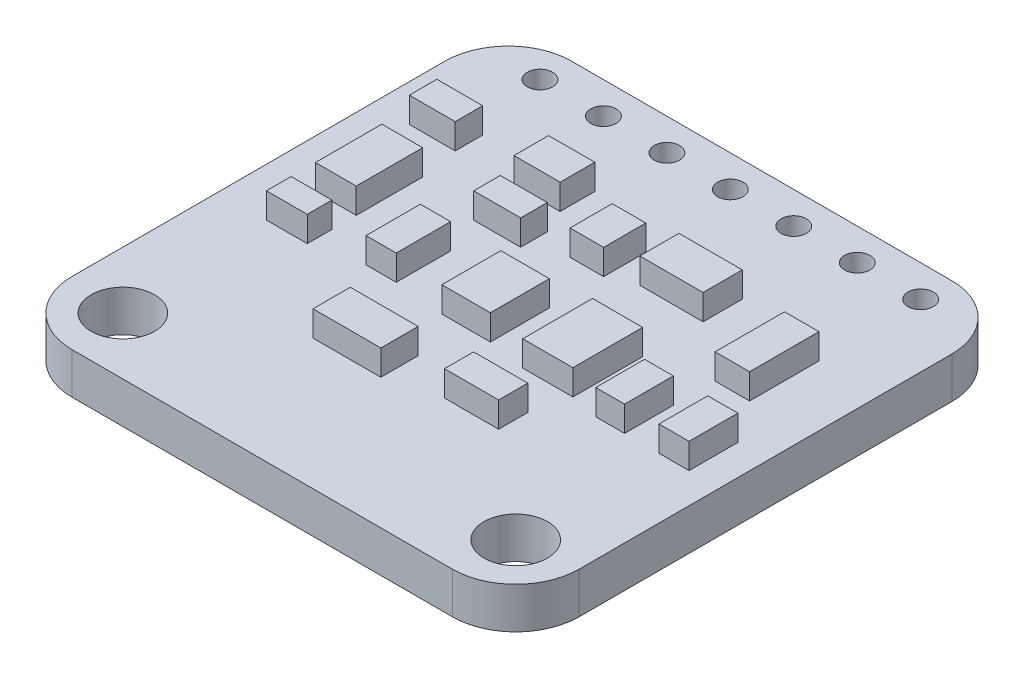
from build123d import *

# Parameters (mm, degrees)
PCB_DEPTH          = 1.651
SKETCH2_R          = 1.27
SKETCH2_R_2        = 0.508
CUT_EXTRUDE1_DEPTH = 15.343929064
SKETCH3_W          = 1.9431
SKETCH3_H          = 2.3622
SKETCH3_W_2        = 2.0066
SKETCH3_H_2        = 2.794
SKETCH3_W_3        = 2.16822249
SKETCH3_H_3        = 1.167787324
SKETCH3_W_4        = 2.716171955
SKETCH3_H_4        = 1.493517176
SKETCH3_W_5        = 1.209663862
SKETCH3_H_5        = 2.17508788
SKETCH3_W_6        = 1.633321627
SKETCH3_H_6        = 2.659890245
SKETCH3_W_7        = 1.834361491
SKETCH3_H_7        = 1.100221283
SKETCH3_W_8        = 1.848311781
SKETCH3_H_8        = 1.38602823
SKETCH3_W_9        = 1.877433771
SKETCH3_H_9        = 1.066217503
SKETCH3_H_10       = 0.988618516
SKETCH3_W_10       = 1.152895283
SKETCH3_H_11       = 1.952725423
SKETCH3_W_11       = 1.201658639
SKETCH3_W_12       = 1.378437796
SKETCH3_H_12       = 2.778082819
SKETCH3_W_13       = 2.534678464
SKETCH3_H_13       = 1.568516227
SKETCH3_W_14       = 1.344087022
SKETCH3_H_14       = 1.688234225
COMPONENTS_DEPTH   = 1.016


with BuildPart() as part:
    # Sketch1 → pcb (new body)
    with BuildSketch(Plane(origin=(0, 0, 0), x_dir=(1, 0, 0), z_dir=(0, 1, 0))):
        with BuildLine():
            Line((-7.61, -10), (7.61, -10))
            ThreePointArc((7.61, -10), (9.406051224, -9.256051224), (10.15, -7.46))
            Line((10.15, -7.46), (10.15, 7.46))
            ThreePointArc((10.15, 7.46), (9.406051224, 9.256051224), (7.61, 10))
            Line((7.61, 10), (-7.61, 10))
            ThreePointArc((-7.61, 10), (-9.406051224, 9.256051224), (-10.15, 7.46))
            Line((-10.15, 7.46), (-10.15, -7.46))
            ThreePointArc((-10.15, -7.46), (-9.406051224, -9.256051224), (-7.61, -10))
        make_face()
    extrude(amount=PCB_DEPTH)

    # Sketch2 → Cut-Extrude1 (cut, through all)
    with BuildSketch(Plane.XZ):
        with Locations((-7.864, 7.714)):
            Circle(SKETCH2_R)
        with Locations((7.864, 7.714)):
            Circle(SKETCH2_R)
        with Locations((-7.61, -8.73)):
            Circle(SKETCH2_R_2)
        with Locations((-5.07, -8.73)):
            Circle(SKETCH2_R_2)
        with Locations((-2.53, -8.73)):
            Circle(SKETCH2_R_2)
        with Locations((0.01, -8.73)):
            Circle(SKETCH2_R_2)
        with Locations((2.55, -8.73)):
            Circle(SKETCH2_R_2)
        with Locations((5.09, -8.73)):
            Circle(SKETCH2_R_2)
        with Locations((7.63, -8.73)):
            Circle(SKETCH2_R_2)
    extrude(amount=-CUT_EXTRUDE1_DEPTH, mode=Mode.SUBTRACT)

    # Sketch3 → components (add)
    with BuildSketch(Plane(origin=(0, 1.651, 0), x_dir=(1, 0, 0), z_dir=(0, 1, 0))):
        with Locations((-0.47355, -0.1829)):
            Rectangle(SKETCH3_W, SKETCH3_H)
        with Locations((3.0507, -0.221)):
            Rectangle(SKETCH3_W_2, SKETCH3_H_2)
        with Locations((2.603432781, -3.639116092)):
            Rectangle(SKETCH3_W_3, SKETCH3_H_3)
        with Locations((-1.831635977, -4.030732119)):
            Rectangle(SKETCH3_W_4, SKETCH3_H_4)
        with Locations((-4.061190046, -0.08934394)):
            Rectangle(SKETCH3_W_5, SKETCH3_H_5)
        with Locations((-7.395465276, 1.673424229)):
            Rectangle(SKETCH3_W_6, SKETCH3_H_6)
        with Locations((-7.750024191, 5.108202568)):
            Rectangle(SKETCH3_W_7, SKETCH3_H_7)
        with Locations((-3.555135742, 5.251106041)):
            Rectangle(SKETCH3_W_8, SKETCH3_H_8)
        with Locations((-3.122473161, 3.062543074)):
            Rectangle(SKETCH3_W_9, SKETCH3_H_9)
        with Locations((-7.395465276, -1.123690742)):
            Rectangle(SKETCH3_W_6, SKETCH3_H_10)
        with Locations((5.77539067, -0.868377737)):
            Rectangle(SKETCH3_W_10, SKETCH3_H_11)
        with Locations((8.331105427, -0.868377737)):
            Rectangle(SKETCH3_W_11, SKETCH3_H_11)
        with Locations((7.041057209, 3.169050517)):
            Rectangle(SKETCH3_W_12, SKETCH3_H_12)
        with Locations((2.786660768, 4.379909938)):
            Rectangle(SKETCH3_W_13, SKETCH3_H_13)
        with Locations((-0.174043511, 4.013167629)):
            Rectangle(SKETCH3_W_14, SKETCH3_H_14)
    extrude(amount=COMPONENTS_DEPTH)


solid = part.part
